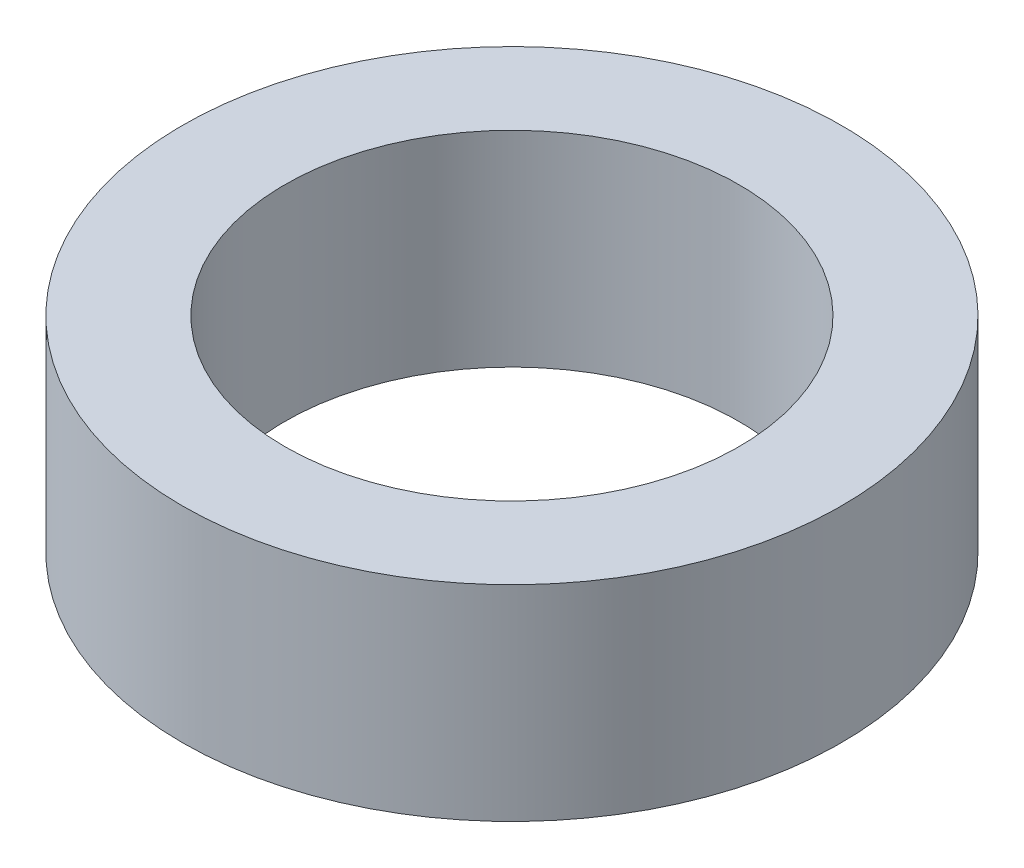
from build123d import *

# Parameters (mm, degrees)
AXLE_TENSION_BEARING_R   = 10.205128061
AXLE_TENSION_BEARING_R_2 = 7.030128061
BOSS_EXTRUDE1_DEPTH      = 6.35


with BuildPart() as part:
    # Axle Tension Bearing → Boss-Extrude1 (new body)
    with BuildSketch(Plane(origin=(0, 0, 0), x_dir=(1, 0, 0), z_dir=(0, 1, 0))):
        Circle(AXLE_TENSION_BEARING_R)
        Circle(AXLE_TENSION_BEARING_R_2, mode=Mode.SUBTRACT)
    extrude(amount=BOSS_EXTRUDE1_DEPTH)


solid = part.part
